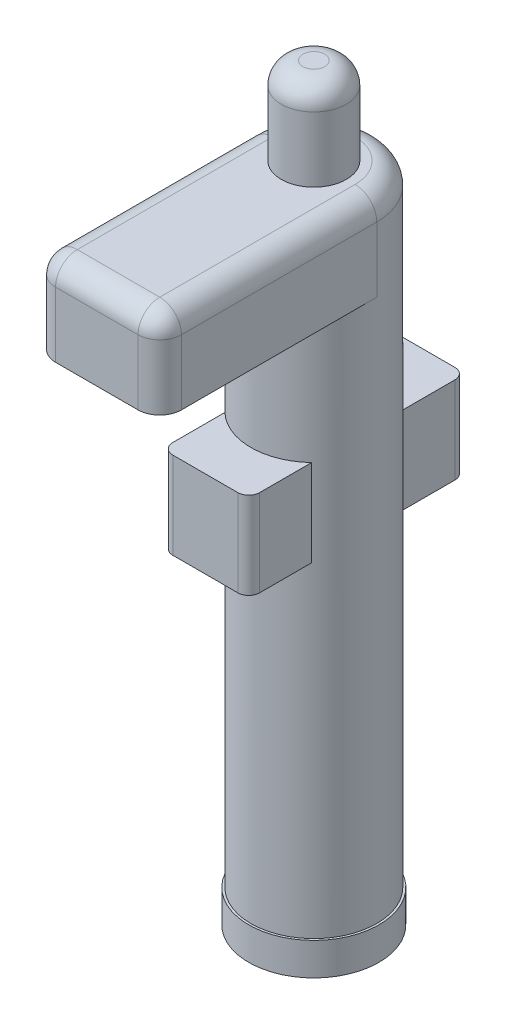
from build123d import *

# Parameters (mm, degrees)
SKETCH2_R                = 2.9
BOSS_EXTRUDE1_DEPTH      = 25
BOSS_EXTRUDE2_DEPTH      = 4
SKETCH5_R                = 2.9
BOSS_EXTRUDE3_DEPTH      = 4
FILLET1_R                = 1
BOSS_EXTRUDE6_DEPTH      = 5
BOSS_EXTRUDE6_DEPTH_BACK = 5
SKETCH6_W                = 4
SKETCH6_H                = 4
FILLET3_R                = 0.5
SKETCH7_R                = 1.5
BOSS_EXTRUDE4_DEPTH      = 4
FILLET2_R                = 1
SKETCH8_R                = 3
BOSS_EXTRUDE5_DEPTH      = 1.5


with BuildPart() as part:
    # Sketch2 → Boss-Extrude1 (new body)
    with BuildSketch(Plane(origin=(0, 0, 0), x_dir=(1, 0, 0), z_dir=(0, 1, 0))):
        Circle(SKETCH2_R)
    extrude(amount=BOSS_EXTRUDE1_DEPTH)



with BuildPart() as body_2:
    # Sketch4 → Boss-Extrude2 (new body)
    with BuildSketch(Plane(origin=(0, 25, 0), x_dir=(1, 0, 0), z_dir=(0, 1, 0))):
        with BuildLine():
            Line((-2.9, 0), (-2.9, -10))
            Line((-2.9, -10), (2.9, -10))
            Line((2.9, -10), (2.9, 0))
            ThreePointArc((2.9, 0), (0, -2.9), (-2.9, 0))
        make_face()
    extrude(amount=BOSS_EXTRUDE2_DEPTH)


with BuildPart() as part_1:
    add(part.part)

    add(body_2.part)  # Boss-Extrude3 merges body 2
    # Sketch5 → Boss-Extrude3 (add)
    with BuildSketch(Plane(origin=(0, 25, 0), x_dir=(1, 0, 0), z_dir=(0, 1, 0))):
        Circle(SKETCH5_R)
    extrude(amount=BOSS_EXTRUDE3_DEPTH)

    # Fillet1
    fillet1_edges = [part_1.edges().sort_by_distance(p)[0] for p in [
        (0, 29, -2.9),
        (2.9, 29, 5),
        (-2.9, 29, 5),
        (-2.9, 27, 10),
        (2.9, 27, 10),
        (0, 29, 10),
    ]]
    fillet(fillet1_edges, radius=FILLET1_R)

    # Sketch6 → Boss-Extrude6 (add, two sides: drawn at the far end of the back side and taken through both)
    with BuildSketch(Plane.XY.offset(-BOSS_EXTRUDE6_DEPTH_BACK)):
        with Locations((0, 17)):
            Rectangle(SKETCH6_W, SKETCH6_H)
    extrude(amount=BOSS_EXTRUDE6_DEPTH + BOSS_EXTRUDE6_DEPTH_BACK)

    # Fillet3
    fillet3_edges = [part_1.edges().sort_by_distance(p)[0] for p in [
        (-2, 17, -5),
        (2, 17, -5),
        (2, 17, 5),
        (-2, 17, 5),
    ]]
    fillet(fillet3_edges, radius=FILLET3_R)

    # Sketch7 → Boss-Extrude4 (add)
    with BuildSketch(Plane(origin=(0, 29, 0), x_dir=(1, 0, 0), z_dir=(0, 1, 0))):
        Circle(SKETCH7_R)
    extrude(amount=BOSS_EXTRUDE4_DEPTH)

    # Fillet2
    fillet2_edges = [part_1.edges().sort_by_distance(p)[0] for p in [
        (-1.5, 33, 0),
    ]]
    fillet(fillet2_edges, radius=FILLET2_R)

    # Sketch8 → Boss-Extrude5 (add)
    with BuildSketch(Plane(origin=(0, 0, 0), x_dir=(-1, 0, 0), z_dir=(0, -1, 0))):
        Circle(SKETCH8_R)
    extrude(amount=BOSS_EXTRUDE5_DEPTH)


solid = part_1.part
